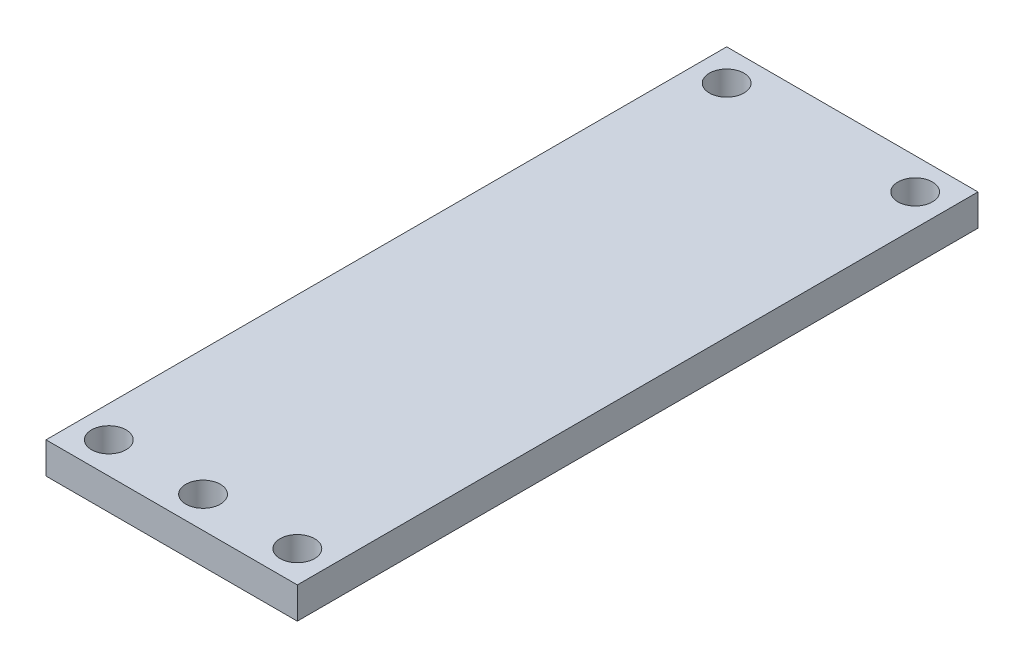
from build123d import *

# Parameters (mm, degrees)
SKETCH1_W           = 24
SKETCH1_H           = 65
BOSS_EXTRUDE1_DEPTH = 3
SKETCH2_R           = 1.65
CUT_EXTRUDE1_DEPTH  = 70.354163538


with BuildPart() as part:
    # Sketch1 → Boss-Extrude1 (new body)
    with BuildSketch(Plane(origin=(0, 0, 0), x_dir=(1, 0, 0), z_dir=(0, 1, 0))):
        with Locations((12, 32.5)):
            Rectangle(SKETCH1_W, SKETCH1_H)
    extrude(amount=BOSS_EXTRUDE1_DEPTH)

    # Sketch2 → Cut-Extrude1 (cut, through all)
    with BuildSketch(Plane(origin=(0, 0, 0), x_dir=(1, 0, 0), z_dir=(0, 1, 0))):
        with Locations((3, 3)):
            Circle(SKETCH2_R)
        with Locations((12, 3)):
            Circle(SKETCH2_R)
        with Locations((21, 3)):
            Circle(SKETCH2_R)
        with Locations((3, 62)):
            Circle(SKETCH2_R)
        with Locations((21, 62)):
            Circle(SKETCH2_R)
    extrude(amount=CUT_EXTRUDE1_DEPTH, mode=Mode.SUBTRACT)


solid = part.part
